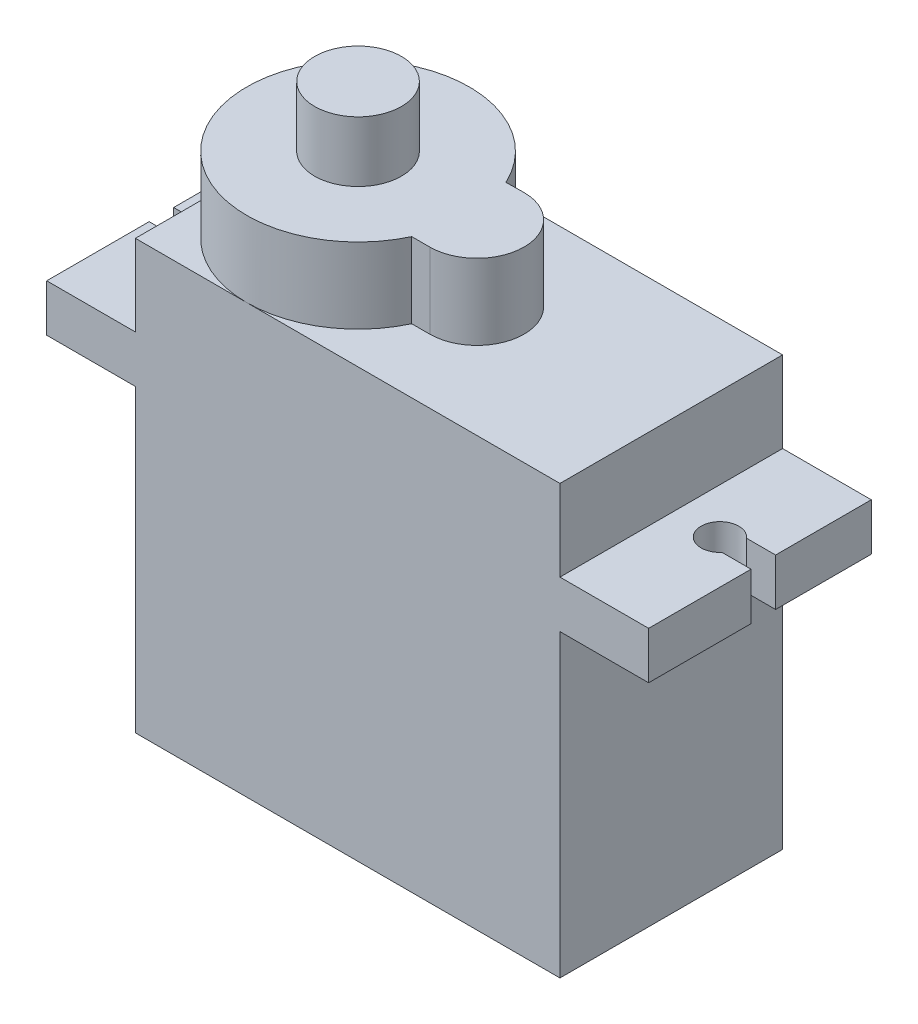
from build123d import *

# Parameters (mm, degrees)
SKETCH1_W           = 22.5
SKETCH1_H           = 22.7
BOSS_EXTRUDE1_DEPTH = 5.9
SKETCH2_W           = 4.7
SKETCH2_H           = 2.5
BOSS_EXTRUDE2_DEPTH = 11.8
CUT_EXTRUDE1_REACH  = 27.055
BOSS_EXTRUDE3_DEPTH = 4
SKETCH5_R           = 2.3
BOSS_EXTRUDE4_DEPTH = 3.2
SHELL3_START        = 1
SHELL3_OUTLINE_W    = 20.5
SHELL3_OUTLINE_H    = 9.8
SHELL3_DEPTH        = 20.7
SHELL3_START_2      = 21.7
SHELL3_2_DEPTH      = 4
SHELL3_START_3      = 16.9
SHELL3_3_DEPTH      = 0.5
SHELL3_START_4      = 25.7
SHELL3_4_OUTLINE_R  = 1.3
SHELL3_4_DEPTH      = 3.2


# Read off the part's stored shape, not the designer's step: Shell3
with BuildPart() as part:
    # Sketch1 → Boss-Extrude1 (new, symmetric)
    with BuildSketch(Plane.XY):
        with Locations((0, 11.35)):
            Rectangle(SKETCH1_W, SKETCH1_H)
    extrude(amount=BOSS_EXTRUDE1_DEPTH, both=True)

    # Sketch2 → Boss-Extrude2 (add)
    with BuildSketch(Plane.XY.offset(5.9)):
        with Locations((13.6, 17.15)):
            Rectangle(SKETCH2_W, SKETCH2_H)
    boss_extrude2 = extrude(amount=-BOSS_EXTRUDE2_DEPTH)

    # Sketch3 → Cut-Extrude1 (cut, up to next)
    with BuildSketch(Plane(origin=(0, 18.4, 0), x_dir=(1, 0, 0), z_dir=(0, 1, 0)), mode=Mode.PRIVATE) as cut_extrude1_sk1:
        with BuildLine():
            Line((15.95, 0.828555983), (14.409934208, 0.828555983))
            ThreePointArc((14.409934208, 0.828555983), (12.65, 0.178555983), (14.409934208, -0.471444017))
            Line((14.409934208, -0.471444017), (15.95, -0.471444017))
            Line((15.95, -0.471444017), (15.95, 0.828555983))
        make_face()
    cut_extrude1_tool1 = extrude(cut_extrude1_sk1.sketch, amount=-CUT_EXTRUDE1_REACH, mode=Mode.PRIVATE) & part.part
    cut_extrude1 = cut_extrude1_tool1.solids().sort_by_distance((14.234181, 18.4, -0.178556))[0]
    add(cut_extrude1, mode=Mode.SUBTRACT)

    # Mirror1: Boss-Extrude2, Cut-Extrude1 across plane
    add(boss_extrude2.mirror(Plane(origin=(0, 0, 0), x_dir=(0, 0, 1), z_dir=(1, 0, 0))))
    add(cut_extrude1.mirror(Plane(origin=(0, 0, 0), x_dir=(0, 0, 1), z_dir=(1, 0, 0))), mode=Mode.SUBTRACT)

    # Sketch4 → Boss-Extrude3 (add)
    with BuildSketch(Plane(origin=(0, 22.7, 0), x_dir=(1, 0, 0), z_dir=(0, 1, 0))):
        with BuildLine():
            Line((0, 2.487468593), (0.95, 2.5))
            ThreePointArc((0.95, 2.5), (3.45, 0), (0.95, -2.5))
            Line((0.95, -2.5), (-0.005844314, -2.5))
            ThreePointArc((-0.005844314, -2.5), (-11.249995949, 0.006913613), (0, 2.487468593))
        make_face()
    extrude(amount=BOSS_EXTRUDE3_DEPTH)

    # Sketch5 → Boss-Extrude4 (add)
    with BuildSketch(Plane(origin=(0, 26.7, 0), x_dir=(1, 0, 0), z_dir=(0, 1, 0))):
        with Locations(Location((-5.35, 0, 0), (0, 0, 270))):
            Circle(SKETCH5_R)
    extrude(amount=BOSS_EXTRUDE4_DEPTH)

    # Shell3 outline → Shell3 (cut)
    with BuildSketch(Plane(origin=(0, 0, 0), x_dir=(1, 0, 0), z_dir=(0, 1, 0)).offset(SHELL3_START)):
        Rectangle(SHELL3_OUTLINE_W, SHELL3_OUTLINE_H)
    extrude(amount=SHELL3_DEPTH, mode=Mode.SUBTRACT)

    # Shell3 2 outline → Shell3 2 (cut)
    with BuildSketch(Plane(origin=(0, 0, 0), x_dir=(1, 0, 0), z_dir=(0, 1, 0)).offset(SHELL3_START_2)):
        with BuildLine():
            Line((-0.685238484, -1.5), (0.95, -1.5))
            ThreePointArc((0.95, -1.5), (2.449997238, -0.002878764), (0.955757517, 1.49998895))
            Line((0.955757517, 1.49998895), (-0.67835846, 1.4784334))
            ThreePointArc((-0.67835846, 1.4784334), (-10.249986927, 0.01131871), (-0.685238484, -1.5))
        make_face()
    extrude(amount=SHELL3_2_DEPTH, mode=Mode.SUBTRACT)

    # Shell3 3 outline → Shell3 3 (cut)
    with BuildSketch(Plane(origin=(0, 0, 0), x_dir=(1, 0, 0), z_dir=(0, 1, 0)).offset(SHELL3_START_3)):
        with BuildLine():
            Line((-14.95, 4.9), (-14.95, 1.828555983))
            Line((-14.95, 1.828555983), (-14.780265456, 1.828555983))
            ThreePointArc((-14.780265456, 1.828555983), (-11.65, 0.178555983), (-14.780265456, -1.471444017))
            Line((-14.780265456, -1.471444017), (-14.95, -1.471444017))
            Line((-14.95, -1.471444017), (-14.95, -4.9))
            Line((-14.95, -4.9), (-10.25, -4.9))
            Line((-10.25, -4.9), (-10.25, 4.9))
            Line((-10.25, 4.9), (-14.95, 4.9))
        make_face()
        with BuildLine():
            Line((14.95, 4.9), (10.25, 4.9))
            Line((10.25, 4.9), (10.25, -4.9))
            Line((10.25, -4.9), (14.95, -4.9))
            Line((14.95, -4.9), (14.95, -1.471444017))
            Line((14.95, -1.471444017), (14.780265456, -1.471444017))
            ThreePointArc((14.780265456, -1.471444017), (11.65, 0.178555983), (14.780265456, 1.828555983))
            Line((14.780265456, 1.828555983), (14.95, 1.828555983))
            Line((14.95, 1.828555983), (14.95, 4.9))
        make_face()
    extrude(amount=SHELL3_3_DEPTH, mode=Mode.SUBTRACT)

    # Shell3 4 outline → Shell3 4 (cut)
    with BuildSketch(Plane(origin=(0, 0, 0), x_dir=(1, 0, 0), z_dir=(0, 1, 0)).offset(SHELL3_START_4)):
        with Locations((-5.35, 0)):
            Circle(SHELL3_4_OUTLINE_R)
    extrude(amount=SHELL3_4_DEPTH, mode=Mode.SUBTRACT)


solid = part.part
